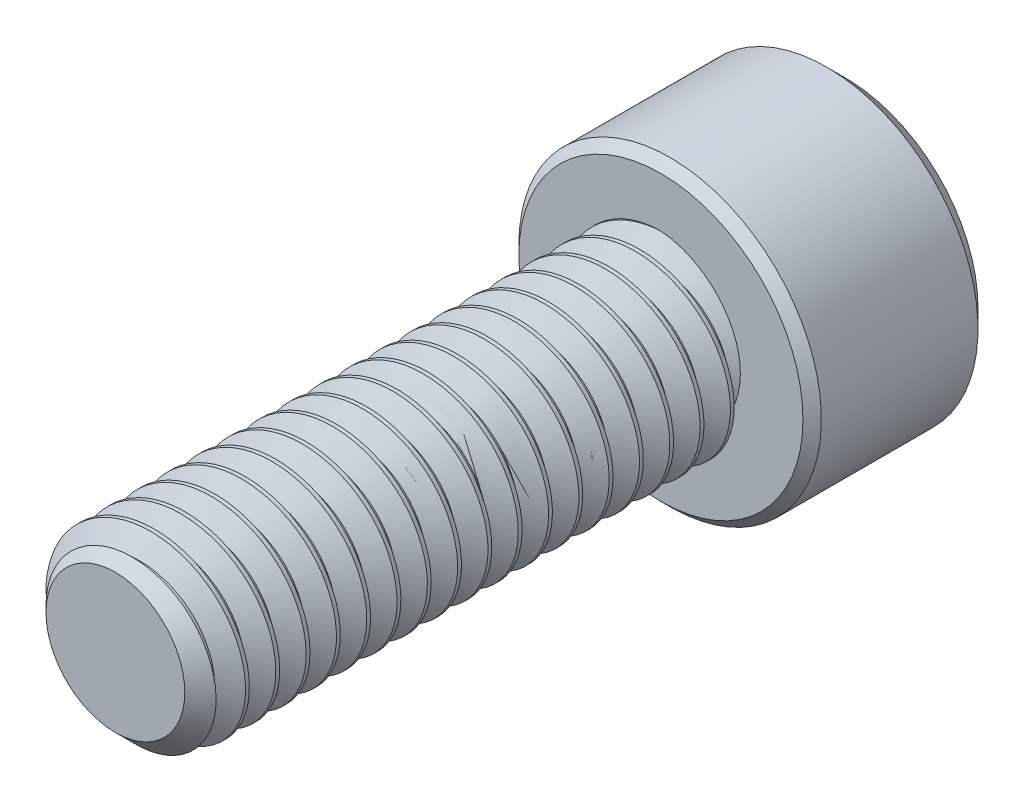
from build123d import *

# Parameters (mm, degrees)
SKETCH1_R          = 2.413
EXTRUDE1_DEPTH     = 14.2875
CHAMFER3_SIZE      = 0.5953125
CUT_SWEEP1_PITCH   = 0.79375
SKETCH6_R          = 3.9624
EXTRUDE2_DEPTH     = 4.826
CUT_EXTRUDE1_DEPTH = 2.9765625
SKETCH8_R          = 2.291358881
CUT_EXTRUDE2_DEPTH = 0.4826
CUT_EXTRUDE2_DRAFT = -45
CHAMFER1_SIZE      = 0.4826
CHAMFER2_SIZE      = 0.2413


with BuildPart() as part:
    # Sketch1 → Extrude1 (new body)
    with BuildSketch(Plane.XY):
        Circle(SKETCH1_R)
    extrude(amount=-EXTRUDE1_DEPTH)

    # Chamfer3
    chamfer3_edges = [part.edges().sort_by_distance(p)[0] for p in [
        (-2.413, 0, 0),
    ]]
    chamfer(chamfer3_edges, length=CHAMFER3_SIZE)

    # Cut-Sweep1: the profile of Sketch3 profile screwed along a right-hand helix of 19 turns, 6 arcs to a turn; built about Z, then put on its axis
    cut_sweep1_z = Axis((0, 0, 0), (0, 0, 1))
    cut_sweep1_corners = [(2.4133, 0, -0.694704455), (1.897444252, 0, -0.396875), (1.897444252, 0, -0.29765625), (2.4133, 0, 0.000173205)]
    with BuildLine(mode=Mode.PRIVATE) as cut_sweep1_profile:
        Line(cut_sweep1_corners[0], cut_sweep1_corners[1])
        Line(cut_sweep1_corners[1], cut_sweep1_corners[2])
        Line(cut_sweep1_corners[2], cut_sweep1_corners[3])
        Line(cut_sweep1_corners[3], cut_sweep1_corners[0])
    cut_sweep1_cap = Face(cut_sweep1_profile.wire())
    cut_sweep1_turn_angles = [0, 30, 60, 90, 120, 150, 180, 210, 240, 270, 300, 330, 360]
    cut_sweep1_turn_weights = [1, 0.8660254037844387, 1, 0.8660254037844387, 1, 0.8660254037844387, 1, 0.8660254037844387, 1, 0.8660254037844387, 1, 0.8660254037844387, 1]
    cut_sweep1_turn_rails = [Edge.make_bspline([Vector(p[0], p[1], 0).rotate(cut_sweep1_z, cut_sweep1_turn_angles[k]) / cut_sweep1_turn_weights[k] + Vector(0, 0, p[2] + CUT_SWEEP1_PITCH * cut_sweep1_turn_angles[k] / 360) for k in range(13)], [0, 0, 0, 1, 1, 2, 2, 3, 3, 4, 4, 5, 5, 6, 6, 6], 2, cut_sweep1_turn_weights) for p in cut_sweep1_corners]
    cut_sweep1_turn_sides = [Face.make_surface_from_curves(cut_sweep1_turn_rails[p[0]], cut_sweep1_turn_rails[p[1]]) for p in [(0, 1), (1, 2), (2, 3), (3, 0)]]
    cut_sweep1 = Plane(origin=(0, 0, 0), x_dir=(0, 1, 0), z_dir=(0, 0, -1)) * Solid(Shell([*[p.moved(Location((0, 0, CUT_SWEEP1_PITCH * i))) for i in range(19) for p in cut_sweep1_turn_sides], cut_sweep1_cap, cut_sweep1_cap.rotate(cut_sweep1_z, 6840).moved(Location((0, 0, CUT_SWEEP1_PITCH * 6840 / 360)))]))
    add(cut_sweep1, mode=Mode.SUBTRACT)

    # Sketch6 → Extrude2 (add)
    with BuildSketch(Plane(origin=(0, 0, -14.2875), x_dir=(-1, 0, 0), z_dir=(0, 0, -1))):
        Circle(SKETCH6_R)
    extrude(amount=EXTRUDE2_DEPTH)

    # Sketch7 → Cut-Extrude1 (cut)
    with BuildSketch(Plane(origin=(0, 0, -19.1135), x_dir=(-1, 0, 0), z_dir=(0, 0, -1))):
        Polygon((0, 2.291358881), (-1.984375, 1.14567944), (-1.984375, -1.14567944), (0, -2.291358881), (1.984375, -1.14567944), (1.984375, 1.14567944), align=None)
    extrude(amount=-CUT_EXTRUDE1_DEPTH, mode=Mode.SUBTRACT)


with BuildPart() as cut_extrude2_tool:
    # Sketch8 → Cut-Extrude2 (with draft: the straight prism first)
    with BuildSketch(Plane(origin=(0, 0, -19.1135), x_dir=(-1, 0, 0), z_dir=(0, 0, -1))):
        Circle(SKETCH8_R)
    extrude(amount=-CUT_EXTRUDE2_DEPTH)
    # Cut-Extrude2: the draft: its side faces are tilted about the plane it starts from
    cut_extrude2_sides = [cut_extrude2_tool.faces().sort_by_distance(p)[0] for p in [
        (2.291358881, 0, -18.8722),
    ]]
    draft(cut_extrude2_sides, Plane(origin=(0, 0, -19.1135), x_dir=(-1, 0, 0), z_dir=(0, 0, -1)), CUT_EXTRUDE2_DRAFT)


with BuildPart() as part_1:
    add(part.part)

    # Cut-Extrude2: cut by cut_extrude2_tool
    add(cut_extrude2_tool.part, mode=Mode.SUBTRACT)

    # Chamfer1
    chamfer1_edges = [part_1.edges().sort_by_distance(p)[0] for p in [
        (3.9624, 0, -19.1135),
    ]]
    chamfer(chamfer1_edges, length=CHAMFER1_SIZE)

    # Chamfer2
    chamfer2_edges = [part_1.edges().sort_by_distance(p)[0] for p in [
        (3.9624, 0, -14.2875),
    ]]
    chamfer(chamfer2_edges, length=CHAMFER2_SIZE)


solid = part_1.part
